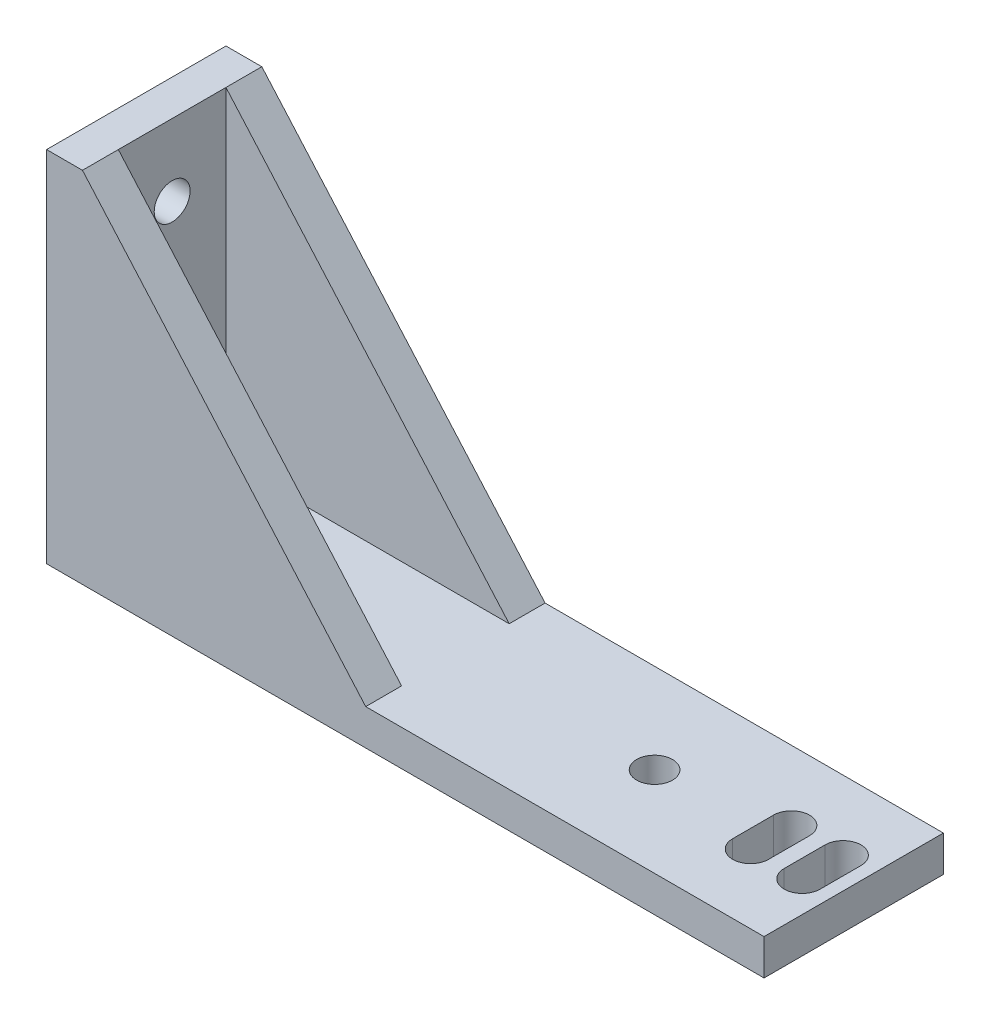
from build123d import *

# Parameters (mm, degrees)
SKETCH1_W                 = 100
SKETCH1_H                 = 15
BOSS_EXTRUDE1_DEPTH       = 5
SKETCH2_W                 = 5
SKETCH2_H                 = 15
BOSS_EXTRUDE2_DEPTH       = 45
SKETCH3_W                 = 55.52
SKETCH3_H                 = 5
BOSS_EXTRUDE3_DEPTH       = 5
F_5_0MM_DOWEL_SLOT1_DEPTH = 5
F_5_0MM_DOWEL_SLOT2_DEPTH = 5
F_5_0MM_DOWEL_HOLE1_D     = 5
F_5_0MM_DOWEL_HOLE2_D     = 5
BOSS_EXTRUDE4_DEPTH       = 5
BOSS_EXTRUDE5_DEPTH       = 5


# Read off the part's stored shape, not the designer's step: Ø5.0mm Dowel Slot1, Ø5.0mm Dowel Slot2
with BuildPart() as part:
    # Sketch1 → Boss-Extrude1 (new body)
    with BuildSketch(Plane(origin=(0, 0, 0), x_dir=(1, 0, 0), z_dir=(0, 1, 0))):
        with Locations((-3.34119197, 9.533232324)):
            Rectangle(SKETCH1_W, SKETCH1_H)
    extrude(amount=BOSS_EXTRUDE1_DEPTH)

    # Sketch2 → Boss-Extrude2 (add)
    with BuildSketch(Plane(origin=(0, 5, 0), x_dir=(1, 0, 0), z_dir=(0, 1, 0))):
        with Locations((-50.84119197, 9.533232324)):
            Rectangle(SKETCH2_W, SKETCH2_H)
    extrude(amount=BOSS_EXTRUDE2_DEPTH)

    # Sketch3 → Boss-Extrude3 (add)
    with BuildSketch(Plane(origin=(0, 0, 0), x_dir=(-1, 0, 0), z_dir=(0, -1, 0))):
        with Locations((-18.89880803, 19.533232324)):
            Rectangle(SKETCH3_W, SKETCH3_H)
        with Locations((-18.89880803, -0.466767676)):
            Rectangle(SKETCH3_W, SKETCH3_H)
    extrude(amount=-BOSS_EXTRUDE3_DEPTH)

    # Ø5.0mm Dowel Slot1 outline → Ø5.0mm Dowel Slot1 (cut)
    with BuildSketch(Plane(origin=(0, 0, 0), x_dir=(1, 0, 0), z_dir=(0, 1, 0))):
        with BuildLine():
            Line((44.842812818, 6.659177942), (44.842812818, 12.359177942))
            ThreePointArc((44.842812818, 12.359177942), (42.342812818, 14.859177942), (39.842812818, 12.359177942))
            Line((39.842812818, 12.359177942), (39.842812818, 6.659177942))
            ThreePointArc((39.842812818, 6.659177942), (42.342812818, 4.159177942), (44.842812818, 6.659177942))
        make_face()
    extrude(amount=F_5_0MM_DOWEL_SLOT1_DEPTH, mode=Mode.SUBTRACT)

    # Ø5.0mm Dowel Slot2 outline → Ø5.0mm Dowel Slot2 (cut)
    with BuildSketch(Plane(origin=(0, 0, 0), x_dir=(1, 0, 0), z_dir=(0, 1, 0))):
        with BuildLine():
            ThreePointArc((37.654614979, 12.36475158), (35.154614979, 14.86475158), (32.654614979, 12.36475158))
            Line((32.654614979, 12.36475158), (32.654614979, 6.66475158))
            ThreePointArc((32.654614979, 6.66475158), (35.154614979, 4.16475158), (37.654614979, 6.66475158))
            Line((37.654614979, 6.66475158), (37.654614979, 12.36475158))
        make_face()
    extrude(amount=F_5_0MM_DOWEL_SLOT2_DEPTH, mode=Mode.SUBTRACT)

    # Ø5.0mm Dowel Hole1 (through all)
    with Locations(Plane.ZY.offset(53.34119197)):
        with Locations((-9.533232324, 40), (-9.958577789, 15)):
            Hole(F_5_0MM_DOWEL_HOLE1_D / 2)

    # Ø5.0mm Dowel Hole2 (through all)
    with Locations(Plane(origin=(0, 5, 0), x_dir=(1, 0, 0), z_dir=(0, 1, 0))):
        with Locations((18.89880803, 9.533232324)):
            Hole(F_5_0MM_DOWEL_HOLE2_D / 2)

    # Sketch15 → Boss-Extrude4 (add)
    with BuildSketch(Plane.XY.offset(-2.033232324)):
        Polygon((-48.34119197, 50), (-8.86119197, 5), (-8.86119197, 0), (-53.34119197, 0), (-53.34119197, 50), align=None)
    extrude(amount=BOSS_EXTRUDE4_DEPTH)

    # Sketch16 → Boss-Extrude5 (add)
    with BuildSketch(Plane(origin=(0, 0, -17.033232324), x_dir=(-1, 0, 0), z_dir=(0, 0, -1))):
        Polygon((48.34119197, 50), (8.86119197, 5), (8.86119197, 0), (53.34119197, 0), (53.34119197, 50), align=None)
    extrude(amount=BOSS_EXTRUDE5_DEPTH)


solid = part.part
